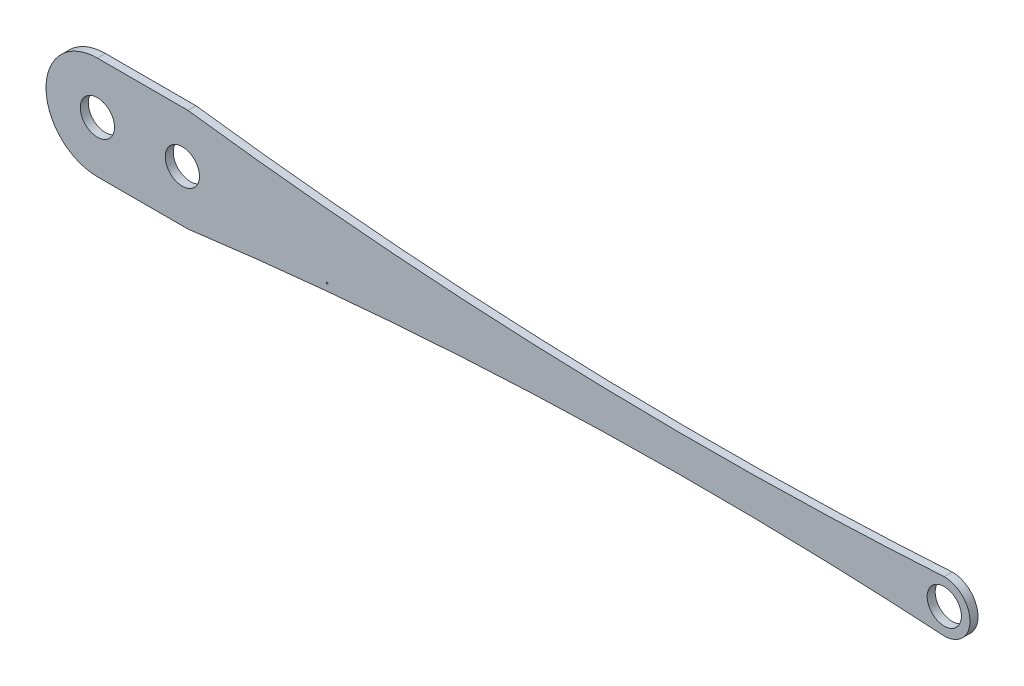
from build123d import *

# Parameters (mm, degrees)
SKETCH4_R               = 8.466666667
BOSS_EXTRUDE2_DEPTH     = 3.96875
SCALE1_SCALE            = 0.75
CUT_EXTRUDE1_DEPTH      = 364.814101002
CUT_EXTRUDE1_DEPTH_BACK = 364.814101002
SKETCH5_R               = 0.28575


with BuildPart() as part:
    # Sketch4 → Boss-Extrude2 (new body)
    with BuildSketch(Plane.XY):
        with BuildLine():
            Line((44.742290553, 25.4), (0, 25.4))
            ThreePointArc((0, 25.4), (-25.4, 0), (0, -25.4))
            Line((0, -25.4), (44.742290553, -25.4))
            add(Edge.make_bspline(
                [(44.742290553, -25.4), (47.961805929, -24.979727511), (51.181693513, -24.570187006)],
                knots=[0, 0, 0, 0.017278923, 0.017278923, 0.017278923], degree=2))
            add(Edge.make_bspline(
                [(51.181693513, -24.570187006), (234.30950949, -1.277989318), (418.641287054, -12.7)],
                knots=[0.017278923, 0.017278923, 0.017278923, 1, 1, 1], degree=2))
            ThreePointArc((418.641287054, -12.7), (431.341287054, 0), (418.641287054, 12.7))
            add(Edge.make_bspline(
                [(51.181693513, 24.570187006), (234.30950949, 1.277989318), (418.641287054, 12.7)],
                knots=[0.017278923, 0.017278923, 0.017278923, 1, 1, 1], degree=2))
            add(Edge.make_bspline(
                [(44.742290553, 25.4), (47.961805929, 24.979727511), (51.181693513, 24.570187006)],
                knots=[0, 0, 0, 0.017278923, 0.017278923, 0.017278923], degree=2))
        make_face()
        Circle(SKETCH4_R, mode=Mode.SUBTRACT)
        with Locations((42.00398, 0)):
            Circle(SKETCH4_R, mode=Mode.SUBTRACT)
        with Locations((418.641287054, 0)):
            Circle(SKETCH4_R, mode=Mode.SUBTRACT)
    extrude(amount=BOSS_EXTRUDE2_DEPTH)


with BuildPart() as part_1:
    # Scale1: scaled about (159.187410946, 0, 1.984375)
    add(part.part.scale(SCALE1_SCALE).moved(Location((39.796852736, 0, 0.49609375))))

    # Sketch5 → Cut-Extrude1 (cut, two sides: drawn at the far end of the back side and taken through both)
    with BuildSketch(Plane.XY.offset(3.47265625).offset(-CUT_EXTRUDE1_DEPTH_BACK)):
        with Locations((124.940154128, -10.64454761)):
            Circle(SKETCH5_R)
    extrude(amount=CUT_EXTRUDE1_DEPTH + CUT_EXTRUDE1_DEPTH_BACK, mode=Mode.SUBTRACT)


solid = part_1.part
